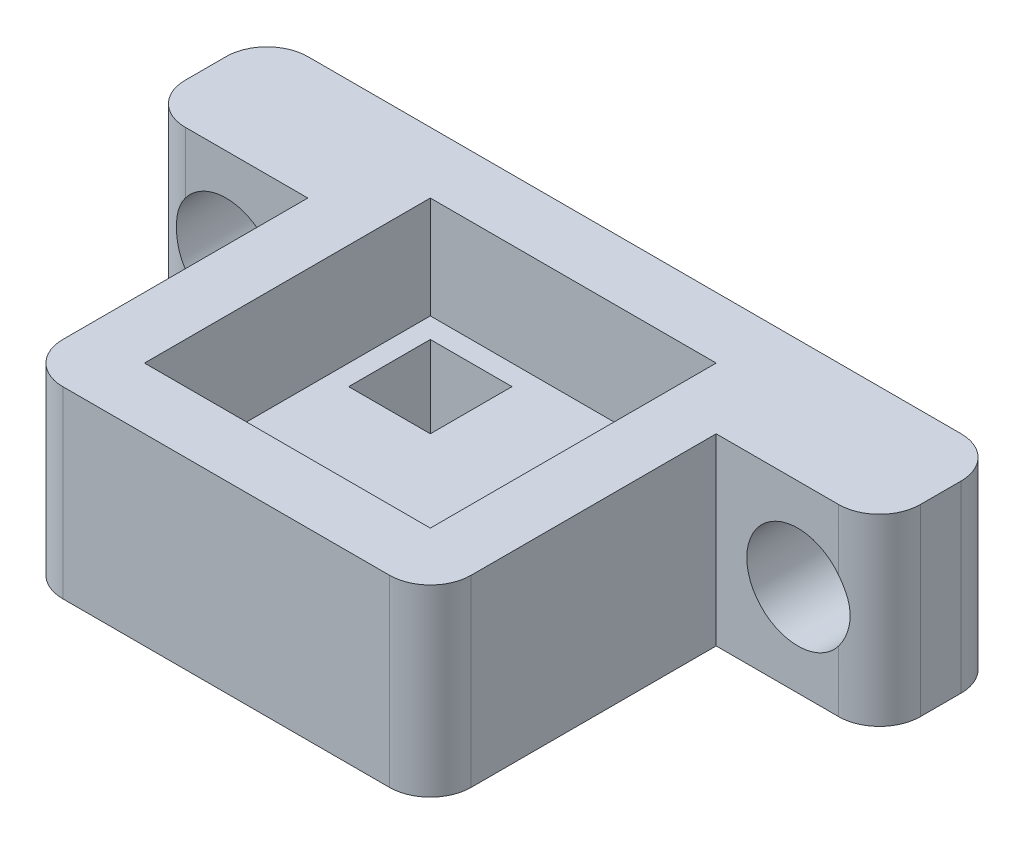
from build123d import *

# Parameters (mm, degrees)
ESBO_O1_W                = 10
ESBO_O1_H                = 10
ESBO_O1_W_2              = 2
ESBO_O1_H_2              = 2
RESSALTO_EXTRUS_O1_DEPTH = 2
ESBO_O2_W                = 10
ESBO_O2_H                = 10
RESSALTO_EXTRUS_O2_DEPTH = 2.5
ESBO_O3_W                = 4
ESBO_O3_H                = 4.5
ESBO_O3_R                = 1.25
RESSALTO_EXTRUS_O3_DEPTH = 3
FILETE1_R                = 1


with BuildPart() as part:
    # Esboço1 → Ressalto-extrusão1 (new body)
    with BuildSketch(Plane(origin=(0, 0, 0), x_dir=(1, 0, 0), z_dir=(0, 1, 0))):
        Rectangle(ESBO_O1_W, ESBO_O1_H)
        with Locations((2, 2)):
            Rectangle(ESBO_O1_W_2, ESBO_O1_H_2, mode=Mode.SUBTRACT)
        with Locations((-2, 2)):
            Rectangle(ESBO_O1_W_2, ESBO_O1_H_2, mode=Mode.SUBTRACT)
        with Locations((2, -2)):
            Rectangle(ESBO_O1_W_2, ESBO_O1_H_2, mode=Mode.SUBTRACT)
        with Locations((-2, -2)):
            Rectangle(ESBO_O1_W_2, ESBO_O1_H_2, mode=Mode.SUBTRACT)
    extrude(amount=RESSALTO_EXTRUS_O1_DEPTH)

    # Esboço2 → Ressalto-extrusão2 (add)
    with BuildSketch(Plane(origin=(0, 2, 0), x_dir=(1, 0, 0), z_dir=(0, 1, 0))):
        Rectangle(ESBO_O2_W, ESBO_O2_H)
        Polygon((-1, -3.5), (3.5, -3.5), (3.5, 3.5), (1, 3.5), (-3.5, 3.5), (-3.5, 1), (-3.5, -3.5), align=None, mode=Mode.SUBTRACT)
    extrude(amount=RESSALTO_EXTRUS_O2_DEPTH)

    # Esboço3 → Ressalto-extrusão3 (add)
    # profile 1 of 2: a face of its own
    with BuildSketch(Plane(origin=(0, 0, -5), x_dir=(-1, 0, 0), z_dir=(0, 0, -1))):
        with Locations((-7, 2.25)):
            Rectangle(ESBO_O3_W, ESBO_O3_H)
        with Locations((-7, 2.25)):
            Circle(ESBO_O3_R, mode=Mode.SUBTRACT)
    # profile 2 of 2: a face of its own
    with BuildSketch(Plane(origin=(0, 0, -5), x_dir=(-1, 0, 0), z_dir=(0, 0, -1))):
        with Locations((7, 2.25)):
            Rectangle(ESBO_O3_W, ESBO_O3_H)
        with Locations((7, 2.25)):
            Circle(ESBO_O3_R, mode=Mode.SUBTRACT)
    extrude(amount=-RESSALTO_EXTRUS_O3_DEPTH)

    # Filete1
    # the kernel refuses this fillet: 1 mm, written as the material it takes off along each edge
    with BuildSketch(Plane(origin=(9, 7, -2), x_dir=(-1, 0, 0), z_dir=(0, -1, 0)), Plane(origin=(-9, 7, -5), x_dir=(1, 0, 0), z_dir=(0, -1, 0)), Plane(origin=(5, 7, 5), x_dir=(-1, 0, 0), z_dir=(0, -1, 0))) as filete1_piece_1:
        with BuildLine():
            CenterArc((FILETE1_R, FILETE1_R), FILETE1_R, 180, 90)
            Line((0, FILETE1_R), (0, 0))
            Line((0, 0), (FILETE1_R, 0))
        make_face()
    extrude(amount=9.5, mode=Mode.SUBTRACT)
    with BuildSketch(Plane(origin=(9, 7, -5), x_dir=(-1, 0, 0), z_dir=(0, -1, 0)), Plane(origin=(-9, 7, -2), x_dir=(1, 0, 0), z_dir=(0, -1, 0)), Plane(origin=(-5, -2.5, 5), x_dir=(0, 0, -1), z_dir=(0, 1, 0))) as filete1_piece_2:
        with BuildLine():
            CenterArc((FILETE1_R, -FILETE1_R), FILETE1_R, 90, 90)
            Line((0, -FILETE1_R), (0, 0))
            Line((0, 0), (FILETE1_R, 0))
        make_face()
    extrude(amount=9.5, mode=Mode.SUBTRACT)


solid = part.part
